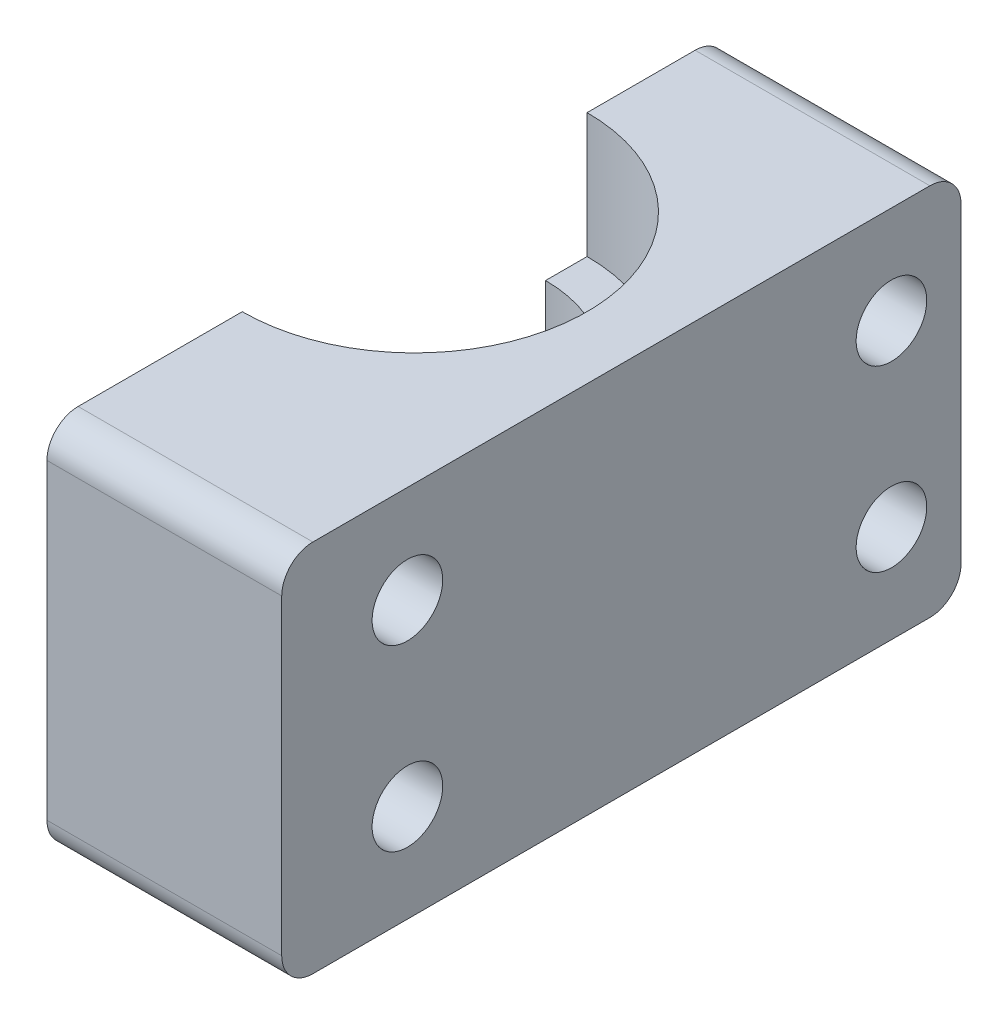
from build123d import *

# Parameters (mm, degrees)
SKETCH8_W           = 30
SKETCH8_H           = 100
BOSS_EXTRUDE1_DEPTH = 100
SKETCH9_W           = 88.7
SKETCH9_H           = 30
CUT_EXTRUDE1_DEPTH  = 103.708324882
SKETCH10_R          = 1.7
CUT_EXTRUDE2_DEPTH  = 21.825225089
MOVE_FACE1_BY       = 2.7
FILLET1_R           = 1.5


with BuildPart() as part:
    # Sketch8 → Boss-Extrude1 (new body)
    with BuildSketch(Plane(origin=(0, 0, 0), x_dir=(0, 0, -1), z_dir=(1, 0, 0))):
        Rectangle(SKETCH8_W, SKETCH8_H)
    extrude(amount=BOSS_EXTRUDE1_DEPTH)

    # Sketch7 → Cut-Revolve3 (revolve, cut)
    with BuildSketch(Plane(origin=(0, 0, 0), x_dir=(0, 0, -1), z_dir=(1, 0, 0))):
        Polygon((-8.3, 9), (-150, 9), (-150, 50), (0, 50), (0, -50), (-150, -50), (-150, -9), (-8.3, -9), (-8.3, -3), (-6.3, -3), (-6.3, 3), (-8.3, 3), align=None)
    revolve(axis=Axis((0, -50, 0), (0, 1, 0)), mode=Mode.SUBTRACT)

    # Sketch9 → Cut-Extrude1 (cut, through all)
    with BuildSketch(Plane(origin=(0, 9, 0), x_dir=(1, 0, 0), z_dir=(0, 1, 0))):
        with Locations((55.65, 0)):
            Rectangle(SKETCH9_W, SKETCH9_H)
    extrude(amount=-CUT_EXTRUDE1_DEPTH, mode=Mode.SUBTRACT)

    # Sketch10 → Cut-Extrude2 (cut, through all)
    with BuildSketch(Plane.ZY):
        with Locations((-11.65, 4.3)):
            Circle(SKETCH10_R)
        with Locations((-11.65, -4.3)):
            Circle(SKETCH10_R)
        with Locations((11.65, -4.3)):
            Circle(SKETCH10_R)
        with Locations((11.65, 4.3)):
            Circle(SKETCH10_R)
    extrude(amount=-CUT_EXTRUDE2_DEPTH, mode=Mode.SUBTRACT)

    # Move Face1: a face moved outward by 2.7
    extrude(part.faces().sort_by_distance((5.65, 0, 15))[0], amount=MOVE_FACE1_BY, dir=(0, 0, 1))

    # Fillet1
    fillet1_edges = [part.edges().sort_by_distance(p)[0] for p in [
        (5.65, 9, -15),
        (5.65, -9, -15),
        (5.65, -9, 17.7),
        (5.65, 9, 17.7),
    ]]
    fillet(fillet1_edges, radius=FILLET1_R)


solid = part.part
